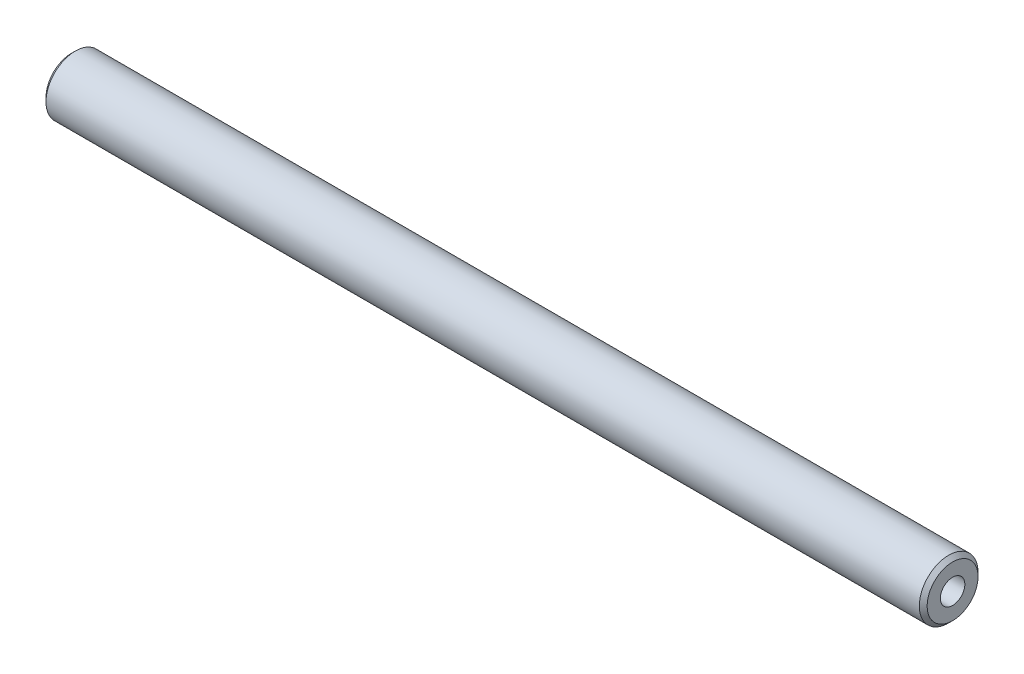
from build123d import *

# Parameters (mm, degrees)
SKETCH1_W           = 90
SKETCH1_H           = 3
CHAMFER1_SIZE       = 0.4
TAPPED_HOLE10_D     = 2.5
TAPPED_HOLE10_DEPTH = 8.5
TAPPED_HOLE10_TIP   = 0.751075774
TAPPED_HOLE11_D     = 2.5
TAPPED_HOLE11_DEPTH = 8.5
TAPPED_HOLE11_TIP   = 0.751075774


with BuildPart() as part:
    # Sketch1 → Revolve1 (revolve)
    with BuildSketch(Plane.XY):
        with Locations((45, 1.5)):
            Rectangle(SKETCH1_W, SKETCH1_H)
    revolve(axis=Axis((0, 0, 0), (1, 0, 0)))

    # Chamfer1
    chamfer1_edges = [part.edges().sort_by_distance(p)[0] for p in [
        (90, -3, 0),
        (0, -3, 0),
    ]]
    chamfer(chamfer1_edges, length=CHAMFER1_SIZE)

    # Tapped Hole10
    with Locations(Plane.ZY):
        with Locations((0, 0)):
            Hole(TAPPED_HOLE10_D / 2, depth=TAPPED_HOLE10_DEPTH)
            with Locations((0, 0, -(TAPPED_HOLE10_DEPTH + TAPPED_HOLE10_TIP / 2))):  # 118° drill point
                Cone(0, TAPPED_HOLE10_D / 2, TAPPED_HOLE10_TIP, mode=Mode.SUBTRACT)

    # Tapped Hole11
    with Locations(Plane(origin=(90, 0, 0), x_dir=(0, 0, -1), z_dir=(1, 0, 0))):
        with Locations((0, 0)):
            Hole(TAPPED_HOLE11_D / 2, depth=TAPPED_HOLE11_DEPTH)
            with Locations((0, 0, -(TAPPED_HOLE11_DEPTH + TAPPED_HOLE11_TIP / 2))):  # 118° drill point
                Cone(0, TAPPED_HOLE11_D / 2, TAPPED_HOLE11_TIP, mode=Mode.SUBTRACT)


solid = part.part
